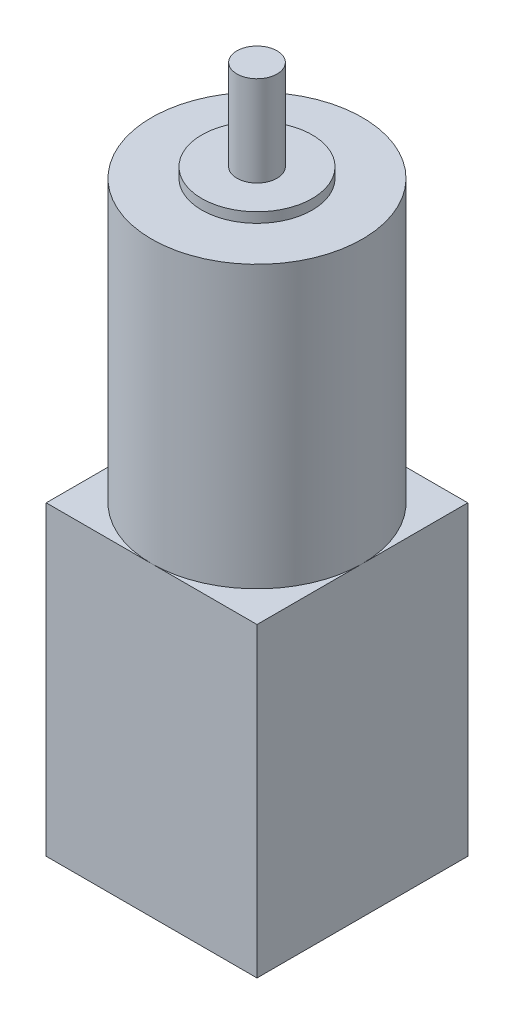
from build123d import *

# Parameters (mm, degrees)
SKETCH1_W           = 42
SKETCH1_H           = 42
BOSS_EXTRUDE1_DEPTH = 61
SKETCH2_R           = 21
BOSS_EXTRUDE2_DEPTH = 56
SKETCH3_R           = 11
BOSS_EXTRUDE3_DEPTH = 2
SKETCH4_R           = 4
BOSS_EXTRUDE4_DEPTH = 18


with BuildPart() as part:
    # Sketch1 → Boss-Extrude1 (new body)
    with BuildSketch(Plane(origin=(0, 0, 0), x_dir=(1, 0, 0), z_dir=(0, 1, 0))):
        with Locations((21, 21)):
            Rectangle(SKETCH1_W, SKETCH1_H)
    extrude(amount=BOSS_EXTRUDE1_DEPTH)

    # Sketch2 → Boss-Extrude2 (add)
    with BuildSketch(Plane(origin=(0, 61, 0), x_dir=(1, 0, 0), z_dir=(0, 1, 0))):
        with Locations((21, 21)):
            Circle(SKETCH2_R)
    extrude(amount=BOSS_EXTRUDE2_DEPTH)

    # Sketch3 → Boss-Extrude3 (add)
    with BuildSketch(Plane(origin=(0, 117, 0), x_dir=(1, 0, 0), z_dir=(0, 1, 0))):
        with Locations((21, 21)):
            Circle(SKETCH3_R)
    extrude(amount=BOSS_EXTRUDE3_DEPTH)

    # Sketch4 → Boss-Extrude4 (add)
    with BuildSketch(Plane(origin=(0, 119, 0), x_dir=(1, 0, 0), z_dir=(0, 1, 0))):
        with Locations((21, 21)):
            Circle(SKETCH4_R)
    extrude(amount=BOSS_EXTRUDE4_DEPTH)


solid = part.part
